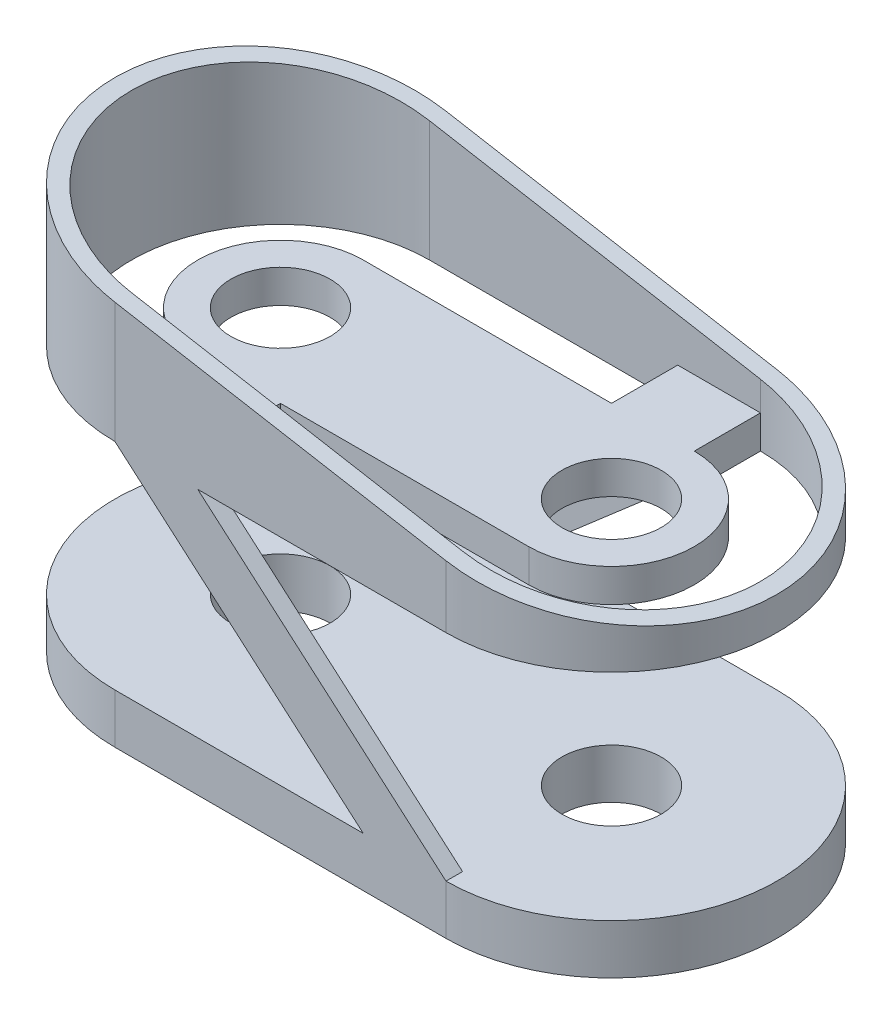
from build123d import *

# Parameters (mm, degrees)
SKETCH1_R               = 15
BOSS_EXTRUDE1_DEPTH     = 15
SKETCH2_R               = 15
SKETCH2_W               = 100
SKETCH2_H               = 5
BOSS_EXTRUDE4_DEPTH     = 10
SKETCH2_7_W             = 100
SKETCH2_7_H             = 5
BOSS_EXTRUDE5_DEPTH     = 40
CUT_EXTRUDE1_DEPTH      = 172.464281995
CUT_EXTRUDE1_DEPTH_BACK = 172.464281995
SKETCH8_OUTSIDE_W       = 253.73
SKETCH8_OUTSIDE_H       = 183.73
LOFT1_START             = 45
LOFT1_DEPTH             = 5
LOFT2_START             = -50
LOFT2_DEPTH             = 5


# Read off the part's stored shape, not the designer's step: Loft1, Loft2
with BuildPart() as part:
    # Sketch1 → Boss-Extrude1 (new body)
    with BuildSketch(Plane(origin=(0, 0, 0), x_dir=(1, 0, 0), z_dir=(0, 1, 0))):
        with BuildLine():
            Line((-50, -50), (50, -50))
            ThreePointArc((50, -50), (100, 0), (50, 50))
            Line((50, 50), (-50, 50))
            ThreePointArc((-50, 50), (-100, 0), (-50, -50))
        make_face()
        with Locations(Location((50, 0, 0), (0, 0, 270))):
            Circle(SKETCH1_R, mode=Mode.SUBTRACT)
        with Locations(Location((-50, 0, 0), (0, 0, 270))):
            Circle(SKETCH1_R, mode=Mode.SUBTRACT)
    extrude(amount=BOSS_EXTRUDE1_DEPTH)



with BuildPart() as body_2:
    # Sketch2 → Boss-Extrude4 (new body)
    # profile 1 of 5: a face of its own
    with BuildSketch(Plane(origin=(0, 90, 0), x_dir=(1, 0, 0), z_dir=(0, 1, 0))):
        with BuildLine():
            Line((50, 45), (25, 45))
            Line((25, 45), (25, 25))
            Line((25, 25), (-50, 25))
            ThreePointArc((-50, 25), (-75, 0), (-50, -25))
            Line((-50, -25), (-50, -43.396517183))
            Line((-50, -43.396517183), (-50, -45))
            Line((-50, -45), (-25, -45))
            Line((-25, -45), (-25, -25))
            Line((-25, -25), (50, -25))
            ThreePointArc((50, -25), (75, 0), (50, 25))
            Line((50, 25), (50, 45))
        make_face()
        with Locations(Location((-50, 0, 0), (0, 0, 270))):
            Circle(SKETCH2_R, mode=Mode.SUBTRACT)
        with Locations(Location((50, 0, 0), (0, 0, 270))):
            Circle(SKETCH2_R, mode=Mode.SUBTRACT)
    # profile 2 of 5: a face of its own
    with BuildSketch(Plane(origin=(0, 90, 0), x_dir=(1, 0, 0), z_dir=(0, 1, 0))):
        with Locations((0, 47.5)):
            Rectangle(SKETCH2_W, SKETCH2_H)
    # profile 3 of 5: a face of its own
    with BuildSketch(Plane(origin=(0, 90, 0), x_dir=(1, 0, 0), z_dir=(0, 1, 0))):
        with BuildLine():
            ThreePointArc((-50, 45), (-95, 0), (-50, -45))
            Line((-50, -45), (-50, -50))
            ThreePointArc((-50, -50), (-100, 0), (-50, 50))
            Line((-50, 50), (-50, 45))
        make_face()
    # profile 4 of 5: a face of its own
    with BuildSketch(Plane(origin=(0, 90, 0), x_dir=(1, 0, 0), z_dir=(0, 1, 0))):
        with BuildLine():
            ThreePointArc((50, -45), (95, 0), (50, 45))
            Line((50, 45), (50, 50))
            ThreePointArc((50, 50), (100, 0), (50, -50))
            Line((50, -50), (50, -45))
        make_face()
    # profile 5 of 5: a face of its own
    with BuildSketch(Plane(origin=(0, 90, 0), x_dir=(1, 0, 0), z_dir=(0, 1, 0))):
        with Locations((0, -47.5)):
            Rectangle(SKETCH2_W, SKETCH2_H)
    extrude(amount=-BOSS_EXTRUDE4_DEPTH)

    # Sketch2<7> → Boss-Extrude5 (add)
    with BuildSketch(Plane(origin=(0, 90, 0), x_dir=(1, 0, 0), z_dir=(0, 1, 0))):
        with Locations((0, 47.5)):
            Rectangle(SKETCH2_7_W, SKETCH2_7_H)
        with BuildLine():
            ThreePointArc((50, -45), (95, 0), (50, 45))
            Line((50, 45), (50, 50))
            ThreePointArc((50, 50), (100, 0), (50, -50))
            Line((50, -50), (50, -45))
        make_face()
        with Locations((0, -47.5)):
            Rectangle(SKETCH2_7_W, SKETCH2_7_H)
        with BuildLine():
            ThreePointArc((-50, 45), (-95, 0), (-50, -45))
            Line((-50, -45), (-50, -50))
            ThreePointArc((-50, -50), (-100, 0), (-50, 50))
            Line((-50, 50), (-50, 45))
        make_face()
    extrude(amount=BOSS_EXTRUDE5_DEPTH)

    # Sketch8 outside → Cut-Extrude1 (cut, two sides: drawn at the far end of the back side and taken through both)
    with BuildSketch(Plane.XY.offset(-CUT_EXTRUDE1_DEPTH_BACK)):
        with Locations((0, 65)):
            Rectangle(SKETCH8_OUTSIDE_W, SKETCH8_OUTSIDE_H)
        Polygon((100, 90), (-100, 125.265396142), (-100, 0), (100, 0), align=None, mode=Mode.SUBTRACT)
    extrude(amount=CUT_EXTRUDE1_DEPTH + CUT_EXTRUDE1_DEPTH_BACK, mode=Mode.SUBTRACT)


with BuildPart() as part_1:
    add(part.part)

    add(body_2.part)  # Loft1 merges body 2
    # Loft1 outline → Loft1 (add)
    with BuildSketch(Plane.XY.offset(LOFT1_START)):
        Polygon((-25, 80), (-50, 80), (25, 15), (50, 15), align=None)
    extrude(amount=LOFT1_DEPTH)

    # Loft2 outline → Loft2 (add)
    with BuildSketch(Plane.XY.offset(LOFT2_START)):
        Polygon((-50, 15), (-25, 15), (50, 80), (25, 80), align=None)
    extrude(amount=LOFT2_DEPTH)


solid = part_1.part
